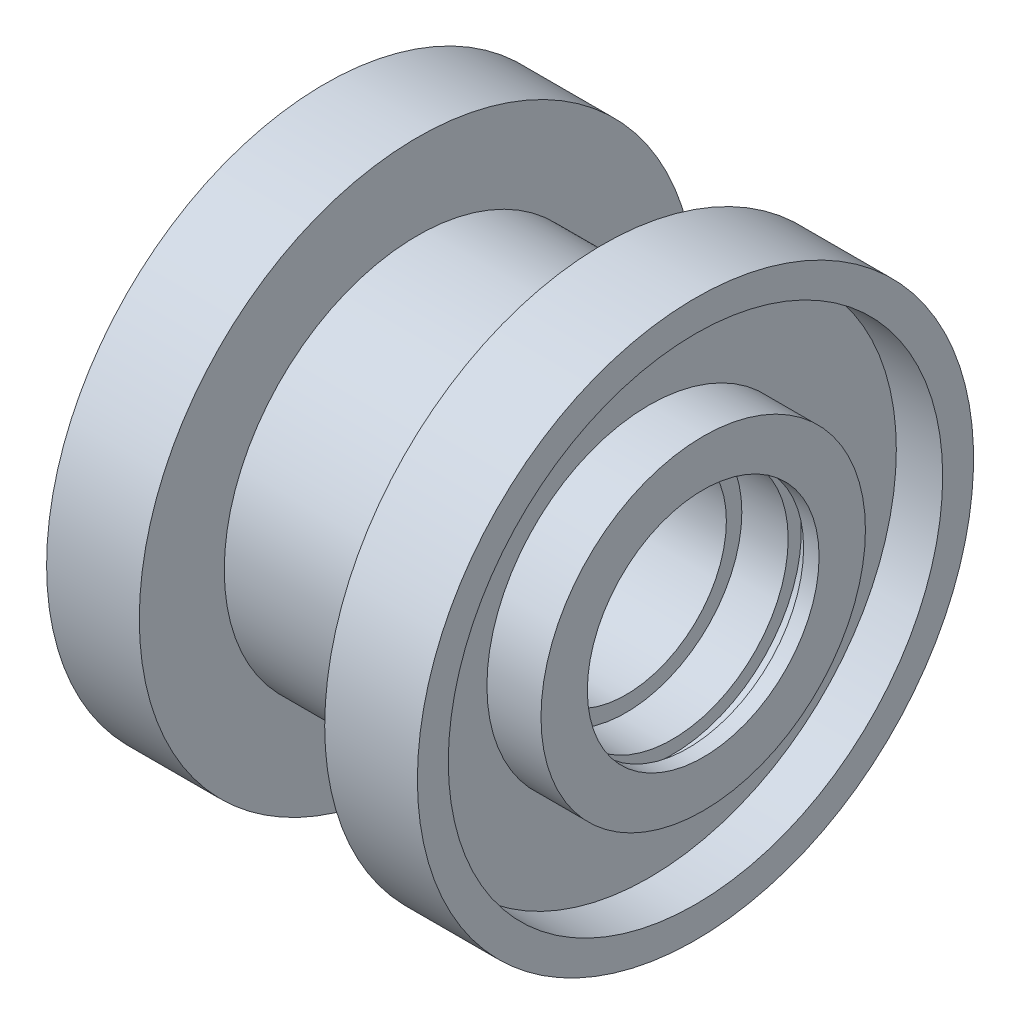
from build123d import *

# Parameters (mm, degrees)
SZKIC2_R                   = 0.5
WYTNIJ_WYCI_GNI_CIE1_DEPTH = 1


with BuildPart() as part:
    # Szkic1 → Obrót1 (revolve)
    with BuildSketch(Plane.XY):
        Polygon((-6, 12.5), (6, 12.5), (6, 18), (12, 18), (12, 16), (9, 16), (9, 10.5), (12.5, 10.5), (12.5, 7.5), (11.5, 7.5), (11.5, 8.35), (10.5, 8.35), (10.5, 7.5), (7.5, 7.5), (7.5, 6.5), (-7.5, 6.5), (-7.5, 7.5), (-10.5, 7.5), (-10.5, 8.35), (-11.5, 8.35), (-11.5, 7.5), (-12.5, 7.5), (-12.5, 10.5), (-9, 10.5), (-9, 16), (-12, 16), (-12, 18), (-6, 18), align=None)
    revolve(axis=Axis((-30.837457467, 0, 0), (1, 0, 0)))

    # Szkic2 → Wytnij-wyciągnięcie1 (cut)
    with BuildSketch(Plane.ZY.offset(12)):
        with Locations((0, 17)):
            Circle(SZKIC2_R)
    extrude(amount=-WYTNIJ_WYCI_GNI_CIE1_DEPTH, mode=Mode.SUBTRACT)


solid = part.part
